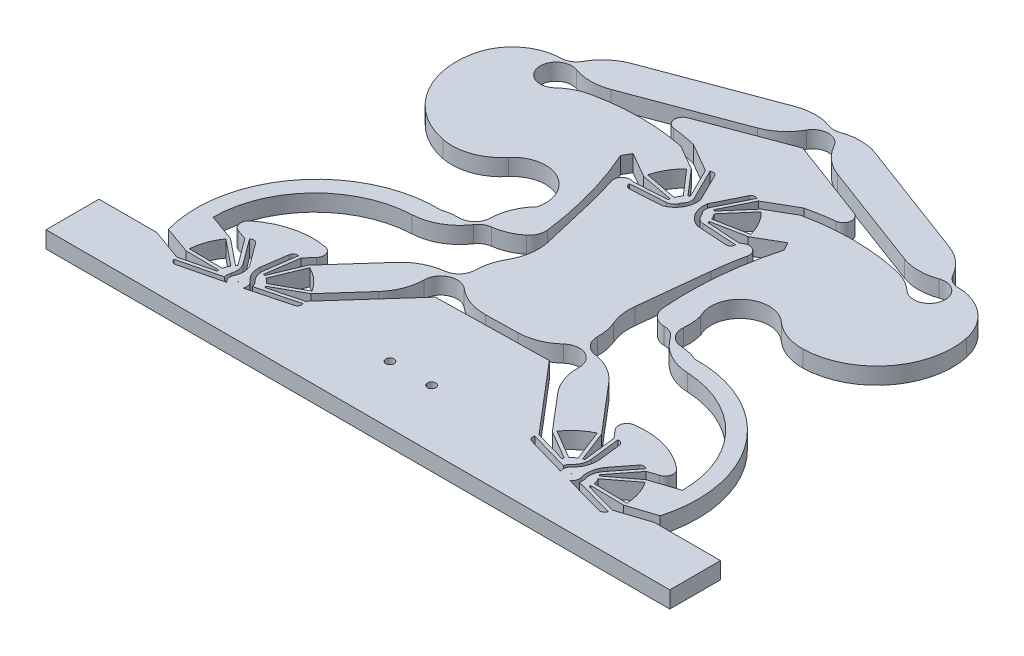
from build123d import *

# Parameters (mm, degrees)
SKETCH1_W           = 300
SKETCH1_H           = 300
BOSS_EXTRUDE1_DEPTH = 10
SKETCH6_W           = 37.369314657
SKETCH6_H           = 300
BOSS_EXTRUDE2_DEPTH = 10
SKETCH11_W          = 80.943448591
SKETCH11_H          = 300
BOSS_EXTRUDE3_DEPTH = 10
SKETCH2_R           = 0.1
CUT_EXTRUDE1_DEPTH  = 10
SKETCH7_R           = 0.1
CUT_EXTRUDE5_DEPTH  = 10
SKETCH9_R           = 0.1
CUT_EXTRUDE7_DEPTH  = 10
CUT_EXTRUDE6_DEPTH  = 10
SKETCH10_R          = 0.1
CUT_EXTRUDE8_DEPTH  = 10
SKETCH12_R          = 0.1
CUT_EXTRUDE10_DEPTH = 10
CUT_EXTRUDE12_DEPTH = 10
CUT_EXTRUDE13_DEPTH = 10
FILLET1_R           = 30
FILLET2_R           = 30
FILLET3_R           = 30
FILLET4_R           = 10
CUT_EXTRUDE14_DEPTH = 10
BOSS_EXTRUDE4_DEPTH = 10
BOSS_EXTRUDE5_DEPTH = 10
FILLET7_R           = 5
FILLET8_R           = 5
CUT_EXTRUDE15_DEPTH = 10
FILLET9_R           = 5
FILLET10_R          = 5
SKETCH22_R          = 2.5
CUT_EXTRUDE16_DEPTH = 10
BOSS_EXTRUDE6_DEPTH = 10
FILLET11_R          = 30
FILLET12_R          = 10
BOSS_EXTRUDE7_DEPTH = 10
CUT_EXTRUDE17_DEPTH = 10
FILLET13_R          = 5


with BuildPart() as part:
    # Sketch1 → Boss-Extrude1 (new body)
    with BuildSketch(Plane(origin=(0, 0, 0), x_dir=(1, 0, 0), z_dir=(0, 1, 0))):
        Rectangle(SKETCH1_W, SKETCH1_H)
    extrude(amount=BOSS_EXTRUDE1_DEPTH)

    # Sketch6 → Boss-Extrude2 (add)
    with BuildSketch(Plane(origin=(0, 10, 0), x_dir=(1, 0, 0), z_dir=(0, 1, 0))):
        with Locations((168.684657329, 0)):
            Rectangle(SKETCH6_W, SKETCH6_H)
    extrude(amount=-BOSS_EXTRUDE2_DEPTH)

    # Sketch11 → Boss-Extrude3 (add)
    with BuildSketch(Plane(origin=(0, 10, 0), x_dir=(1, 0, 0), z_dir=(0, 1, 0))):
        with Locations((-190.471724295, 0)):
            Rectangle(SKETCH11_W, SKETCH11_H)
    extrude(amount=-BOSS_EXTRUDE3_DEPTH)

    # Sketch2 → Cut-Extrude1 (cut)
    with BuildSketch(Plane(origin=(0, 10, 0), x_dir=(1, 0, 0), z_dir=(0, 1, 0))):
        with Locations(Location((-102.597986042, -119.22892065, 0), (0, 0, 270))):
            Circle(SKETCH2_R)
        with BuildLine():
            Line((-91.646532135, -114.32324462), (-72.286712388, -109.303545489))
            Line((-72.286712388, -109.303545489), (-58.964237394, -94.401135072))
            Line((-58.964237394, -94.401135072), (-63.056122105, -90.743067))
            Line((-63.056122105, -90.743067), (-74.626488646, -103.685583383))
            Line((-74.626488646, -103.685583383), (-92.108674519, -113.400169175))
            ThreePointArc((-92.108674519, -113.400169175), (-91.867672783, -113.856735121), (-91.646532135, -114.32324462))
        make_face()
        with BuildLine():
            Line((-95.822049131, -117.472025954), (-71.695255072, -111.216324777))
            ThreePointArc((-71.695255072, -111.216324777), (-71.829497948, -113.351526598), (-73.434237682, -114.766418238))
            Line((-73.434237682, -114.766418238), (-97.973067223, -121.128953786))
            ThreePointArc((-97.973067223, -121.128953786), (-99.265576377, -115.50131474), (-105.002307179, -114.8449453))
            Line((-105.002307179, -114.8449453), (-101.418143006, -89.749332515))
            ThreePointArc((-101.418143006, -89.749332515), (-100.191185318, -87.996710822), (-98.084304532, -87.625010239))
            Line((-98.084304532, -87.625010239), (-101.608286421, -112.299238503))
            ThreePointArc((-101.608286421, -112.299238503), (-99.643858028, -112.882809425), (-97.93261251, -114.010272376))
            ThreePointArc((-97.93261251, -114.010272376), (-96.621211776, -115.584998398), (-95.822049131, -117.472025954))
        make_face()
        with BuildLine():
            Line((-93.226843981, -111.733475602), (-75.652632512, -101.967752581))
            ThreePointArc((-75.652632512, -101.967752581), (-81.270564181, -95.372242827), (-88.451852215, -90.525490581))
            Line((-88.451852215, -90.525490581), (-96.195220365, -109.079802872))
            ThreePointArc((-96.195220365, -109.079802872), (-94.600202844, -110.282666466), (-93.226843981, -111.733475602))
        make_face()
        with BuildLine():
            Line((-82.794990967, -73.096889004), (-78.703106256, -76.754957075))
            Line((-78.703106256, -76.754957075), (-90.273472796, -89.697473458))
            Line((-90.273472796, -89.697473458), (-97.976293575, -108.154627953))
            ThreePointArc((-97.976293575, -108.154627953), (-98.456903938, -107.966086237), (-98.945179165, -107.79839127))
            Line((-98.945179165, -107.79839127), (-96.11746596, -87.999299421))
            Line((-96.11746596, -87.999299421), (-82.794990967, -73.096889004))
        make_face()
    extrude(amount=-CUT_EXTRUDE1_DEPTH, mode=Mode.SUBTRACT)

    # Sketch7 → Cut-Extrude5 (cut)
    with BuildSketch(Plane(origin=(0, 10, 0), x_dir=(1, 0, 0), z_dir=(0, 1, 0))):
        with Locations(Location((97.402013958, -119.22892065, 0), (0, 0, 270))):
            Circle(SKETCH7_R)
        with BuildLine():
            Line((94.028008861, -107.71301471), (91.682181806, -87.851063763))
            Line((91.682181806, -87.851063763), (78.725718188, -72.629361273))
            Line((78.725718188, -72.629361273), (74.546162669, -76.186930412))
            Line((74.546162669, -76.186930412), (85.798653908, -89.406747095))
            Line((85.798653908, -89.406747095), (93.050753939, -108.045605567))
            ThreePointArc((93.050753939, -108.045605567), (93.535803353, -107.868796727), (94.028008861, -107.71301471))
        make_face()
        with BuildLine():
            Line((96.580974488, -112.277237818), (93.657533723, -87.524672641))
            ThreePointArc((93.657533723, -87.524672641), (95.754761468, -87.947453617), (96.938774133, -89.729368873))
            Line((96.938774133, -89.729368873), (99.912141189, -114.904656402))
            ThreePointArc((99.912141189, -114.904656402), (94.161156338, -115.4214488), (92.732296027, -121.016022899))
            Line((92.732296027, -121.016022899), (68.355298748, -114.059154531))
            ThreePointArc((68.355298748, -114.059154531), (66.785409855, -112.605690794), (66.703084838, -110.467857649))
            Line((66.703084838, -110.467857649), (90.670763986, -117.307912108))
            ThreePointArc((90.670763986, -117.307912108), (91.515539141, -115.440858582), (92.86481329, -113.89846006))
            ThreePointArc((92.86481329, -113.89846006), (94.602947197, -112.812907459), (96.580974488, -112.277237818))
        make_face()
        with BuildLine():
            Line((91.247727873, -108.927233275), (83.957453048, -90.190260523))
            ThreePointArc((83.957453048, -90.190260523), (76.66052519, -94.861100811), (70.884003253, -101.318166667))
            Line((70.884003253, -101.318166667), (88.215752445, -111.508001053))
            ThreePointArc((88.215752445, -111.508001053), (89.62395567, -110.09098821), (91.247727873, -108.927233275))
        make_face()
        with BuildLine():
            Line((54.38437804, -93.348310961), (58.563933558, -89.790741823))
            Line((58.563933558, -89.790741823), (69.816424797, -103.010558506))
            Line((69.816424797, -103.010558506), (87.057418022, -113.147034846))
            ThreePointArc((87.057418022, -113.147034846), (86.805394414, -113.597610478), (86.572984435, -114.058609287))
            Line((86.572984435, -114.058609287), (67.340841659, -108.570013451))
            Line((67.340841659, -108.570013451), (54.38437804, -93.348310961))
        make_face()
    extrude(amount=-CUT_EXTRUDE5_DEPTH, mode=Mode.SUBTRACT)

    # Sketch9 → Cut-Extrude7 (cut)
    with BuildSketch(Plane(origin=(0, 10, 0), x_dir=(1, 0, 0), z_dir=(0, 1, 0))):
        with Locations(Location((-4.298011449, 51.362589388, 0), (0, 0, 270))):
            Circle(SKETCH9_R)
        with BuildLine():
            Line((-9.192265136, 40.406026019), (-20.278753654, 23.760012312))
            Line((-20.278753654, 23.760012312), (-20.27739859, 3.770760841))
            Line((-20.27739859, 3.770760841), (-14.788775596, 3.771132913))
            Line((-14.788775596, 3.771132913), (-14.789952449, 21.131493244))
            Line((-14.789952449, 21.131493244), (-8.232489324, 40.025928334))
            ThreePointArc((-8.232489324, 40.025928334), (-8.716466361, 40.205651807), (-9.192265136, 40.406026019))
        make_face()
        with BuildLine():
            Line((-8.17828243, 45.53648459), (-21.994600391, 24.791717858))
            ThreePointArc((-21.994600391, 24.791717858), (-23.317706894, 26.472936806), (-23.064483156, 28.597315705))
            Line((-23.064483156, 28.597315705), (-9.012211208, 49.696359924))
            ThreePointArc((-9.012211208, 49.696359924), (-4.297672501, 46.362589399), (0.416414174, 49.696999087))
            Line((0.416414174, 49.696999087), (14.471546586, 28.599860259))
            ThreePointArc((14.471546586, 28.599860259), (14.725058343, 26.475515711), (13.402179791, 24.794117393))
            Line((13.402179791, 24.794117393), (-0.416950604, 45.537010728))
            ThreePointArc((-0.416950604, 45.537010728), (-2.270353792, 44.662693536), (-4.297536921, 44.362589404))
            ThreePointArc((-4.297536921, 44.362589404), (-6.32476072, 44.662418689), (-8.17828243, 45.53648459))
        make_face()
        with BuildLine():
            Line((-6.288015442, 39.52874453), (-12.879996817, 20.534849815))
            ThreePointArc((-12.879996817, 20.534849815), (-4.29584218, 19.362589461), (4.288153443, 20.536013638))
            Line((4.288153443, 20.536013638), (-2.30640305, 39.529014442))
            ThreePointArc((-2.30640305, 39.529014442), (-4.297197973, 39.362589415), (-6.288015442, 39.52874453))
        make_face()
        with BuildLine():
            Line((11.687828011, 3.772927752), (6.199205018, 3.772555681))
            Line((6.199205018, 3.772555681), (6.198028165, 21.132916012))
            Line((6.198028165, 21.132916012), (-0.361996594, 40.026461872))
            ThreePointArc((-0.361996594, 40.026461872), (0.121956073, 40.20625096), (0.597727677, 40.40668968))
            Line((0.597727677, 40.40668968), (11.686472947, 23.762179223))
            Line((11.686472947, 23.762179223), (11.687828011, 3.772927752))
        make_face()
    extrude(amount=-CUT_EXTRUDE7_DEPTH, mode=Mode.SUBTRACT)

    # Sketch8 → Cut-Extrude6 (cut)
    with BuildSketch(Plane(origin=(0, 10, 0), x_dir=(1, 0, 0), z_dir=(0, 1, 0))):
        with BuildLine():
            Line((-78.703106256, -76.754957075), (-54.138077533, -49.276718976))
            ThreePointArc((-54.138077533, -49.276718976), (-40.018046382, -48.486326488), (-40.80843887, -34.366295337))
            Line((-40.80843887, -34.366295337), (-14.789952449, -5.262231469))
            Line((-14.789952449, -5.262231469), (-14.788775596, 3.771132913))
            Line((-14.788775596, 3.771132913), (-20.27739859, 3.770760841))
            Line((-20.27739859, 3.770760841), (-20.278753654, -3.166742642))
            Line((-20.278753654, -3.166742642), (-82.794990967, -73.096889004))
            Line((-82.794990967, -73.096889004), (-78.703106256, -76.754957075))
        make_face()
        with BuildLine():
            Line((54.38437804, -93.348310961), (31.817052737, -66.835435083))
            Line((31.817052737, -66.835435083), (-35.451668434, -68.100169764))
            Line((-35.451668434, -68.100169764), (-58.964237394, -94.401135072))
            Line((-58.964237394, -94.401135072), (-63.056122105, -90.743067))
            Line((-63.056122105, -90.743067), (-44.463192374, -69.945169474))
            ThreePointArc((-44.463192374, -69.945169474), (-41.897795613, -53.368842887), (-27.798433074, -62.455307527))
            Line((-27.798433074, -62.455307527), (24.304404998, -61.475710098))
            ThreePointArc((24.304404998, -61.475710098), (38.411339196, -52.170792129), (40.784353275, -68.902674721))
            Line((40.784353275, -68.902674721), (58.563933558, -89.790741823))
            Line((58.563933558, -89.790741823), (54.38437804, -93.348310961))
        make_face()
        with BuildLine():
            Line((74.546162669, -76.186930412), (50.315381049, -47.719768401))
            ThreePointArc((50.315381049, -47.719768401), (36.218722109, -46.586539941), (37.351950569, -32.489881001))
            Line((37.351950569, -32.489881001), (6.199182178, 4.109470961))
            Line((6.199182178, 4.109470961), (11.686472947, 6.130667405))
            Line((11.686472947, 6.130667405), (78.725718188, -72.629361273))
            Line((78.725718188, -72.629361273), (74.546162669, -76.186930412))
        make_face()
    extrude(amount=-CUT_EXTRUDE6_DEPTH, mode=Mode.SUBTRACT)

    # Sketch10 → Cut-Extrude8 (cut)
    with BuildSketch(Plane(origin=(0, 10, 0), x_dir=(1, 0, 0), z_dir=(0, 1, 0))):
        with Locations(Location((-102.597986042, -119.22892065, 0), (0, 0, 270))):
            Circle(SKETCH10_R)
        with Locations(Location((97.402013958, -119.22892065, 0), (0, 0, 270))):
            Circle(SKETCH10_R)
        with BuildLine():
            Line((-111.248936494, -110.912607989), (-123.155436608, -94.842908084))
            Line((-123.155436608, -94.842908084), (-141.963397914, -88.073065567))
            Line((-141.963397914, -88.073065567), (-143.822252577, -93.237331424))
            Line((-143.822252577, -93.237331424), (-127.487824755, -99.1168365))
            Line((-127.487824755, -99.1168365), (-111.931675559, -111.686889094))
            ThreePointArc((-111.931675559, -111.686889094), (-111.598635825, -111.292403562), (-111.248936494, -110.912607989))
        make_face()
        with BuildLine():
            Line((-106.765261082, -113.604525683), (-121.603502345, -93.577978677))
            ThreePointArc((-121.603502345, -93.577978677), (-119.573489424, -92.902585823), (-117.660478654, -93.860446858))
            Line((-117.660478654, -93.860446858), (-102.568831079, -114.229005652))
            ThreePointArc((-102.568831079, -114.229005652), (-107.302504691, -117.535549963), (-105.762062656, -123.10043446))
            Line((-105.762062656, -123.10043446), (-130.372961181, -129.178237322))
            ThreePointArc((-130.372961181, -129.178237322), (-132.457590158, -128.697165606), (-133.591476371, -126.882941247))
            Line((-133.591476371, -126.882941247), (-109.39382345, -120.907191762))
            ThreePointArc((-109.39382345, -120.907191762), (-109.588633741, -118.867195958), (-109.18431215, -116.858201688))
            ThreePointArc((-109.18431215, -116.858201688), (-108.215510969, -115.05238935), (-106.765261082, -113.604525683))
        make_face()
        with BuildLine():
            Line((-113.058133277, -113.347992167), (-128.696169481, -100.711771269))
            ThreePointArc((-128.696169481, -100.711771269), (-132.706905393, -108.39134825), (-134.510577976, -116.865347918))
            Line((-134.510577976, -116.865347918), (-114.406602423, -117.094306126))
            ThreePointArc((-114.406602423, -117.094306126), (-113.888830799, -115.164831), (-113.058133277, -113.347992167))
        make_face()
        with BuildLine():
            Line((-152.789193488, -118.149266566), (-150.930338825, -112.985000709))
            Line((-150.930338825, -112.985000709), (-134.595911003, -118.864505784))
            Line((-134.595911003, -118.864505784), (-114.597207903, -119.092265075))
            ThreePointArc((-114.597207903, -119.092265075), (-114.591980926, -119.608508214), (-114.564553874, -120.124048762))
            Line((-114.564553874, -120.124048762), (-133.981232182, -124.919109083))
            Line((-133.981232182, -124.919109083), (-152.789193488, -118.149266566))
        make_face()
        with BuildLine():
            Line((109.339089265, -120.45620754), (128.615034544, -125.788930446))
            Line((128.615034544, -125.788930446), (147.603841538, -119.544301943))
            Line((147.603841538, -119.544301943), (145.889199465, -114.330379709))
            Line((145.889199465, -114.330379709), (129.397709918, -119.753744416))
            Line((129.397709918, -119.753744416), (109.400399943, -119.425729562))
            ThreePointArc((109.400399943, -119.425729562), (109.380830595, -119.941628138), (109.339089265, -120.45620754))
        make_face()
        with BuildLine():
            Line((104.148594805, -121.095373667), (128.170861961, -127.741174559))
            ThreePointArc((128.170861961, -127.741174559), (126.98700331, -129.523192141), (124.889812113, -129.946154377))
            Line((124.889812113, -129.946154377), (100.457294578, -123.186857023))
            ThreePointArc((100.457294578, -123.186857023), (102.151768339, -117.66692407), (97.51179845, -114.230126059))
            Line((97.51179845, -114.230126059), (113.163582067, -94.28876995))
            ThreePointArc((113.163582067, -94.28876995), (115.102469441, -93.384433885), (117.112932016, -94.11597213))
            Line((117.112932016, -94.11597213), (101.723960046, -113.722489681))
            ThreePointArc((101.723960046, -113.722489681), (103.133419476, -115.210091121), (104.051670092, -117.042125438))
            ThreePointArc((104.051670092, -117.042125438), (104.40001343, -119.061578544), (104.148594805, -121.095373667))
        make_face()
        with BuildLine():
            Line((109.265383569, -117.423245857), (129.367958664, -117.752987369))
            ThreePointArc((129.367958664, -117.752987369), (127.800441998, -109.232142536), (124.004640252, -101.444087948))
            Line((124.004640252, -101.444087948), (108.021530578, -113.640909667))
            ThreePointArc((108.021530578, -113.640909667), (108.801424473, -115.480128857), (109.265383569, -117.423245857))
        make_face()
        with BuildLine():
            Line((137.617926587, -89.178906854), (139.332568661, -94.392829088))
            Line((139.332568661, -94.392829088), (122.841079114, -99.816193795))
            Line((122.841079114, -99.816193795), (106.941663391, -111.949148079))
            ThreePointArc((106.941663391, -111.949148079), (106.619713465, -111.545560982), (106.280702199, -111.156195266))
            Line((106.280702199, -111.156195266), (118.629119593, -95.423535356))
            Line((118.629119593, -95.423535356), (137.617926587, -89.178906854))
        make_face()
    extrude(amount=-CUT_EXTRUDE8_DEPTH, mode=Mode.SUBTRACT)

    # Sketch12 → Cut-Extrude10 (cut)
    # profile 1 of 7: a face of its own
    with BuildSketch(Plane(origin=(0, 10, 0), x_dir=(1, 0, 0), z_dir=(0, 1, 0))):
        with BuildLine():
            Line((27.561332768, 49.322329568), (2.687678802, 50.915228543))
            ThreePointArc((2.687678802, 50.915228543), (1.954036453, 54.510905928), (-0.497914525, 57.241302118))
            Line((-0.497914525, 57.241302118), (-0.951262483, 58.125887496))
            Line((-0.951262483, 58.125887496), (9.860864618, 79.97564065))
            ThreePointArc((9.860864618, 79.97564065), (7.743291685, 80.280587924), (6.030311219, 78.998868028))
            Line((6.030311219, 78.998868028), (-2.836944994, 61.079419098))
            Line((-2.836944994, 61.079419098), (-3.864486369, 59.002905828))
            Line((-3.864486369, 59.002905828), (-4.181817653, 58.361624964))
            ThreePointArc((-4.181817653, 58.361624964), (-4.298485976, 58.362589372), (-4.415154168, 58.361609146))
            Line((-4.415154168, 58.361609146), (-4.732601523, 59.002905828))
            Line((-4.732601523, 59.002905828), (-5.760493391, 61.079419098))
            Line((-5.760493391, 61.079419098), (-14.630080929, 78.997467467))
            ThreePointArc((-14.630080929, 78.997467467), (-16.343235153, 80.278955106), (-18.460766723, 79.973720737))
            Line((-18.460766723, 79.973720737), (-7.907108709, 58.653568704))
            Line((-7.907108709, 58.653568704), (-8.097667773, 57.241586906))
            ThreePointArc((-8.097667773, 57.241586906), (-10.550154793, 54.510716387), (-11.283640982, 50.914281432))
            Line((-11.283640982, 50.914281432), (-36.157078755, 49.31801012))
            ThreePointArc((-36.157078755, 49.31801012), (-35.362384374, 47.331664528), (-33.395892151, 46.489039876))
            Line((-33.395892151, 46.489039876), (-10.417450958, 47.963698379))
            ThreePointArc((-10.417450958, 47.963698379), (-4.297536921, 44.362589404), (1.821888823, 47.964528079))
            Line((1.821888823, 47.964528079), (24.800529738, 46.492984991))
            ThreePointArc((24.800529738, 46.492984991), (26.766907701, 47.335876251), (27.561332768, 49.322329568))
        make_face()
        with Locations((-4.298011449, 51.362589388)):
            Circle(SKETCH12_R, mode=Mode.SUBTRACT)
    # profile 2 of 7: a face of its own
    with BuildSketch(Plane(origin=(0, 10, 0), x_dir=(1, 0, 0), z_dir=(0, 1, 0))):
        with BuildLine():
            ThreePointArc((-16.083393286, 53.621964291), (-16.169667701, 53.112954444), (-16.23396848, 52.600704789))
            Line((-16.23396848, 52.600704789), (-36.192910004, 51.319824917))
            Line((-36.192910004, 51.319824917), (-53.504787112, 61.313277132))
            Line((-53.504787112, 61.313277132), (-50.760797839, 66.066750112))
            Line((-50.760797839, 66.066750112), (-35.725696348, 57.387589131))
            Line((-35.725696348, 57.387589131), (-16.083393286, 53.621964291))
        make_face()
    # profile 3 of 7: a face of its own
    with BuildSketch(Plane(origin=(0, 10, 0), x_dir=(1, 0, 0), z_dir=(0, 1, 0))):
        with BuildLine():
            Line((-13.551419723, 59.002905828), (-26.704624376, 74.208676517))
            ThreePointArc((-26.704624376, 74.208676517), (-32.011908941, 67.360710709), (-35.287691606, 59.340040345))
            Line((-35.287691606, 59.340040345), (-15.541992169, 55.554593392))
            ThreePointArc((-15.541992169, 55.554593392), (-14.690723008, 57.361884883), (-13.551419723, 59.002905828))
        make_face()
    # profile 4 of 7: a face of its own
    with BuildSketch(Plane(origin=(0, 10, 0), x_dir=(1, 0, 0), z_dir=(0, 1, 0))):
        with BuildLine():
            Line((-12.148608978, 60.438277705), (-25.232938194, 75.564424901))
            Line((-25.232938194, 75.564424901), (-40.268039685, 84.243585882))
            Line((-40.268039685, 84.243585882), (-37.524050412, 88.997058862))
            Line((-37.524050412, 88.997058862), (-20.212173304, 79.003606647))
            Line((-20.212173304, 79.003606647), (-11.33954682, 61.079419098))
            ThreePointArc((-11.33954682, 61.079419098), (-11.750975366, 60.767552378), (-12.148608978, 60.438277705))
        make_face()
    # profile 5 of 7: a face of its own
    with BuildSketch(Plane(origin=(0, 10, 0), x_dir=(1, 0, 0), z_dir=(0, 1, 0))):
        with BuildLine():
            ThreePointArc((3.551355533, 60.439342), (3.153677282, 60.768562759), (2.742206457, 61.080373695))
            Line((2.742206457, 61.080373695), (11.61240271, 79.005764023))
            Line((11.61240271, 79.005764023), (28.922924755, 89.001563279))
            Line((28.922924755, 89.001563279), (31.667558475, 84.24846237))
            Line((31.667558475, 84.24846237), (16.633633836, 75.56726302))
            Line((16.633633836, 75.56726302), (3.551355533, 60.439342))
        make_face()
    # profile 6 of 7: a face of its own
    with BuildSketch(Plane(origin=(0, 10, 0), x_dir=(1, 0, 0), z_dir=(0, 1, 0))):
        with BuildLine():
            Line((6.945400819, 55.556117805), (26.690586846, 59.344241831))
            ThreePointArc((26.690586846, 59.344241831), (23.413716774, 67.364467993), (18.105503816, 74.21171418))
            Line((18.105503816, 74.21171418), (4.954360872, 59.004160328))
            ThreePointArc((4.954360872, 59.004160328), (6.093886635, 57.363293864), (6.945400819, 55.556117805))
        make_face()
    # profile 7 of 7: a face of its own
    with BuildSketch(Plane(origin=(0, 10, 0), x_dir=(1, 0, 0), z_dir=(0, 1, 0))):
        with BuildLine():
            Line((7.487063955, 53.623562124), (27.128856296, 57.391850019))
            Line((27.128856296, 57.391850019), (42.162780935, 66.073049368))
            Line((42.162780935, 66.073049368), (44.907414655, 61.31994846))
            Line((44.907414655, 61.31994846), (27.596892611, 51.324149205))
            Line((27.596892611, 51.324149205), (7.63777761, 52.602323046))
            ThreePointArc((7.63777761, 52.602323046), (7.573407381, 53.114563978), (7.487063955, 53.623562124))
        make_face()
    extrude(amount=-CUT_EXTRUDE10_DEPTH, mode=Mode.SUBTRACT)

    # Sketch15 → Cut-Extrude12 (cut)
    with BuildSketch(Plane(origin=(0, 10, 0), x_dir=(1, 0, 0), z_dir=(0, 1, 0))):
        with BuildLine():
            Line((39.420971271, -13.383711862), (42.319060047, -16.772150469))
            ThreePointArc((42.319060047, -16.772150469), (55.713404964, -17.816910854), (54.668644579, -31.211255771))
            Line((54.668644579, -31.211255771), (57.566733355, -34.599694378))
            ThreePointArc((57.566733355, -34.599694378), (113.655857126, -43.702099475), (139.332568661, -94.392829088))
            Line((139.332568661, -94.392829088), (137.617926587, -89.178906854))
            ThreePointArc((137.617926587, -89.178906854), (108.748964829, -42.558722062), (54.034243988, -38.931339213))
            Line((54.034243988, -38.931339213), (34.593978622, -16.201826493))
            Line((34.593978622, -16.201826493), (39.420971271, -13.383711862))
        make_face()
        with BuildLine():
            Line((54.150196743, 1.703691437), (58.27807117, -3.122609672))
            ThreePointArc((58.27807117, -3.122609672), (57.233310785, -16.516954588), (70.627655701, -17.561714973))
            Line((70.627655701, -17.561714973), (74.755530128, -22.388016081))
            ThreePointArc((74.755530128, -22.388016081), (133.603132396, -50.347409216), (145.889199465, -114.330379709))
            Line((145.889199465, -114.330379709), (147.603841538, -119.544301943))
            ThreePointArc((147.603841538, -119.544301943), (138.92427366, -52.04077504), (79.294445881, -19.233082619))
            Line((79.294445881, -19.233082619), (57.970763007, 5.69851744))
            Line((57.970763007, 5.69851744), (54.150196743, 1.703691437))
        make_face()
        with BuildLine():
            Line((-63.632634958, -35.117435005), (-60.172935913, -31.247444248))
            ThreePointArc((-60.172935913, -31.247444248), (-60.923808777, -17.833414654), (-47.509779183, -17.082541791))
            Line((-47.509779183, -17.082541791), (-36.095715199, -4.314864155))
            Line((-36.095715199, -4.314864155), (-31.995348698, -7.980514787))
            Line((-31.995348698, -7.980514787), (-59.89051547, -39.183817785))
            ThreePointArc((-59.89051547, -39.183817785), (-113.491918235, -42.534997648), (-141.963397914, -88.073065567))
            Line((-141.963397914, -88.073065567), (-143.822252577, -93.237331424))
            ThreePointArc((-143.822252577, -93.237331424), (-118.508832551, -43.783095071), (-63.632634958, -35.117435005))
        make_face()
        with BuildLine():
            Line((-79.288579779, -21.121314409), (-75.828880735, -17.251323652))
            ThreePointArc((-75.828880735, -17.251323652), (-62.414851141, -16.500450788), (-63.165724005, -3.086421194))
            Line((-63.165724005, -3.086421194), (-51.75166002, 9.681256442))
            Line((-51.75166002, 9.681256442), (-55.852026521, 13.346907074))
            Line((-55.852026521, 13.346907074), (-83.38894628, -17.455663776))
            ThreePointArc((-83.38894628, -17.455663776), (-143.551518497, -50.253185184), (-152.789193488, -118.149266566))
            Line((-152.789193488, -118.149266566), (-150.930338825, -112.985000709))
            ThreePointArc((-150.930338825, -112.985000709), (-138.285338487, -48.978978096), (-79.288579779, -21.121314409))
        make_face()
    extrude(amount=-CUT_EXTRUDE12_DEPTH, mode=Mode.SUBTRACT)

    # Sketch16 → Cut-Extrude13 (cut)
    with BuildSketch(Plane(origin=(0, 10, 0), x_dir=(1, 0, 0), z_dir=(0, 1, 0))):
        with BuildLine():
            Line((-2.597986042, 119.88932953), (-77.131565185, 92.022366182))
            ThreePointArc((-77.131565185, 92.022366182), (-57.215949643, 91.974166571), (-37.524050412, 88.997058862))
            Line((-37.524050412, 88.997058862), (-40.268039685, 84.243585882))
            ThreePointArc((-40.268039685, 84.243585882), (-73.171891784, 86.824637463), (-105.679139111, 81.114630334))
            ThreePointArc((-105.679139111, 81.114630334), (-124.281418287, 83.485174081), (-105.888772551, 87.142338423))
            Line((-105.888772551, 87.142338423), (-11.49637184, 122.434210909))
            ThreePointArc((-11.49637184, 122.434210909), (-2.597986042, 135.261181031), (6.300399756, 122.434210909))
            Line((6.300399756, 122.434210909), (100.692800467, 87.142338423))
            ThreePointArc((100.692800467, 87.142338423), (119.085291754, 83.480762619), (100.48066117, 81.123095563))
            ThreePointArc((100.48066117, 81.123095563), (66.275606354, 87.122250716), (31.667558475, 84.24846237))
            Line((31.667558475, 84.24846237), (28.922924755, 89.001563279))
            ThreePointArc((28.922924755, 89.001563279), (49.994353332, 92.250590481), (71.314795751, 92.254472799))
            Line((71.314795751, 92.254472799), (-2.597986042, 119.88932953))
        make_face()
        with BuildLine():
            Line((-2.597986042, 154.05282917), (-124.067653953, 108.637181316))
            ThreePointArc((-124.067653953, 108.637181316), (-154.31003633, 42.276329795), (-87.949184809, 12.033947417))
            ThreePointArc((-87.949184809, 12.033947417), (-72.557085493, 28.73900639), (-55.852026521, 13.346907074))
            Line((-55.852026521, 13.346907074), (-51.75166002, 9.681256442))
            ThreePointArc((-51.75166002, 9.681256442), (-66.724858527, 33.233533734), (-90.27713582, 18.260335227))
            ThreePointArc((-90.27713582, 18.260335227), (-146.925506705, 40.578608573), (-130.643893246, 99.247614975))
            ThreePointArc((-130.643893246, 99.247614975), (-118.353914639, 94.773188599), (-113.243127558, 106.812454397))
            Line((-113.243127558, 106.812454397), (-11.49637184, 144.854007547))
            ThreePointArc((-11.49637184, 144.854007547), (-2.597986042, 138.680977669), (6.300399756, 144.854007547))
            Line((6.300399756, 144.854007547), (108.047155473, 106.812454397))
            ThreePointArc((108.047155473, 106.812454397), (113.157942554, 94.773188599), (125.447921161, 99.247614975))
            ThreePointArc((125.447921161, 99.247614975), (141.72953462, 40.578608573), (85.081163735, 18.260335227))
            ThreePointArc((85.081163735, 18.260335227), (61.337358344, 25.447496828), (54.150196743, 1.703691437))
            Line((54.150196743, 1.703691437), (57.970763007, 5.69851744))
            ThreePointArc((57.970763007, 5.69851744), (67.194272877, 21.257457288), (82.753212724, 12.033947417))
            ThreePointArc((82.753212724, 12.033947417), (149.114064246, 42.276329795), (118.871681868, 108.637181316))
            Line((118.871681868, 108.637181316), (-2.597986042, 154.05282917))
        make_face()
        with BuildLine():
            Line((39.420971271, -13.383711862), (34.593978622, -16.201826493))
            ThreePointArc((34.593978622, -16.201826493), (33.600989607, 25.375103098), (42.162780935, 66.073049368))
            Line((42.162780935, 66.073049368), (44.907414655, 61.31994846))
            ThreePointArc((44.907414655, 61.31994846), (38.490889994, 24.237895826), (39.420971271, -13.383711862))
        make_face()
        with BuildLine():
            Line((-31.995348698, -7.980514787), (-36.095715199, -4.314864155))
            ThreePointArc((-36.095715199, -4.314864155), (-42.19724815, 29.189700926), (-53.504787112, 61.313277132))
            Line((-53.504787112, 61.313277132), (-50.760797839, 66.066750112))
            ThreePointArc((-50.760797839, 66.066750112), (-38.486520296, 29.775910296), (-31.995348698, -7.980514787))
        make_face()
    extrude(amount=-CUT_EXTRUDE13_DEPTH, mode=Mode.SUBTRACT)

    # Fillet1
    # the kernel refuses this fillet: 30 mm, written as the material it takes off along each edge
    with BuildSketch(Plane(origin=(-44.463192374, 51.143782777, 69.945169474), x_dir=(-0.666481933166411, 0, 0.7455211819678658), z_dir=(0, -1, 0)), Plane(origin=(24.304404998, 51.143782777, 61.475710098), x_dir=(-0.9998233037234974, 0, 0.01879790763439075), z_dir=(0, -1, 0)), Plane(origin=(50.315381049, 51.143782777, 47.719768401), x_dir=(0.6481715239835826, 0, 0.7614943699705206), z_dir=(0, -1, 0))) as fillet1_piece_1:
        with BuildLine():
            CenterArc((16.457513111, 30), FILLET1_R, 228.590377891, 41.409622109)
            Line((-3.385621722, 7.5), (-3.782484419, 7.05))
            ThreePointArc((-3.782484419, 7.05), (-1.432484419, 3.867515581), (-0.6, 0))
            Line((-0.6, 0), (0, -0.6))
            Line((0, -0.6), (16.457513111, -0.6))
            Line((16.457513111, -0.6), (16.457513111, 0))
        make_face()
    extrude(amount=92.287565553, mode=Mode.SUBTRACT)
    with BuildSketch(Plane(origin=(-27.798433074, 51.578860281, 62.455307527), x_dir=(-0.41893740169155813, 0, -0.9080151174203688), z_dir=(0, -1, 0))) as fillet1_piece_2:
        with BuildLine():
            CenterArc((20.789430141, 27.283838696), FILLET1_R, 203.690415168, 41.740596453)
            Line((-6.682464493, 15.230000915), (-7.231902385, 14.988924159))
            Line((-7.231902385, 14.988924159), (-0.549437893, -0.241076756))
            Line((-0.549437893, -0.241076756), (0.249473162, -0.545676774))
            ThreePointArc((0.249473162, -0.545676774), (4.157886028, 0.305387101), (8.066298895, -0.545676774))
            Line((8.066298895, -0.545676774), (8.315772056, 0))
        make_face()
    extrude(amount=93.157720562, mode=Mode.SUBTRACT)
    with BuildSketch(Plane(origin=(40.784353275, 51.143782777, 68.902674721), x_dir=(0.42737249057440424, 0, -0.904075635276292), z_dir=(0, -1, 0)), Plane(origin=(37.351950569, 51.143782777, 32.489881001), x_dir=(-0.42737249057440385, 0, 0.9040756352762921), z_dir=(0, -1, 0))) as fillet1_piece_3:
        with BuildLine():
            CenterArc((20.571891388, 27.343134833), FILLET1_R, 204.295188945, 41.409622109)
            Line((-6.771243445, 15), (-7.318106141, 14.753137303))
            Line((-7.318106141, 14.753137303), (-0.546862697, -0.246862697))
            Line((-0.546862697, -0.246862697), (0.246862697, -0.546862697))
            ThreePointArc((0.246862697, -0.546862697), (4.114378278, 0.285621722), (7.981893859, -0.546862697))
            Line((7.981893859, -0.546862697), (8.228756555, 0))
        make_face()
    extrude(amount=92.287565553, mode=Mode.SUBTRACT)
    with BuildSketch(Plane(origin=(-40.80843887, 51.143782777, 34.366295337), x_dir=(0.40528032781907436, 0, 0.9141924610730847), z_dir=(0, -1, 0))) as fillet1_piece_4:
        with BuildLine():
            CenterArc((20.571891388, -27.343134833), FILLET1_R, 114.295188945, 41.409622109)
            Line((-6.771243445, -15), (-7.318106141, -14.753137303))
            Line((-7.318106141, -14.753137303), (-0.546862697, 0.246862697))
            Line((-0.546862697, 0.246862697), (0.246862697, 0.546862697))
            ThreePointArc((0.246862697, 0.546862697), (4.114378278, -0.285621722), (7.981893859, 0.546862697))
            Line((7.981893859, 0.546862697), (8.228756555, 0))
        make_face()
    extrude(amount=92.287565553, mode=Mode.SUBTRACT)
    with BuildSketch(Plane(origin=(-54.138077533, 51.143782777, 49.276718976), x_dir=(-0.6664819331664084, 0, 0.7455211819678682), z_dir=(0, -1, 0))) as fillet1_piece_5:
        with BuildLine():
            CenterArc((16.457513111, -30), FILLET1_R, 90, 41.409622109)
            Line((-3.385621722, -7.5), (-3.782484419, -7.05))
            ThreePointArc((-3.782484419, -7.05), (-1.432484419, -3.867515581), (-0.6, 0))
            Line((-0.6, 0), (0, 0.6))
            Line((0, 0.6), (16.457513111, 0.6))
            Line((16.457513111, 0.6), (16.457513111, 0))
        make_face()
    extrude(amount=92.287565553, mode=Mode.SUBTRACT)
    with BuildSketch(Plane(origin=(70.627655701, 27.52004215, 17.561714973), x_dir=(-0.9461098133922329, 0, 0.323845983459598), z_dir=(0, -1, 0))) as fillet1_piece_6:
        with BuildLine():
            CenterArc((18.073306639, -27.884751426), FILLET1_R, 111.644279329, 21.240405079)
            Line((-2.342444274, -5.903006394), (-2.750759293, -5.463371494))
            ThreePointArc((-2.750759293, -5.463371494), (-1.728917166, -2.730197402), (-0.557695029, 0.221305796))
            Line((-0.557695029, 0.221305796), (0.221305796, 0.557695029))
            ThreePointArc((0.221305796, 0.557695029), (3.50400843, -0.069828715), (6.786711064, 0.557695029))
            Line((6.786711064, 0.557695029), (7.00801686, 0))
        make_face()
    extrude(amount=45.0400843, mode=Mode.SUBTRACT)
    with BuildSketch(Plane(origin=(-75.828880735, 26.629934552, 17.251323652), x_dir=(-0.6664819331664106, 0, 0.7455211819678661), z_dir=(0, -1, 0))) as fillet1_piece_7:
        with BuildLine():
            CenterArc((20.31675429, -25.907743314), FILLET1_R, 120.277746344, 18.734914988)
            Line((-2.32888188, -6.23097624), (-2.781794603, -5.837440899))
            ThreePointArc((-2.781794603, -5.837440899), (-1.163273183, -3.115924579), (-0.6, 0))
            Line((-0.6, 0), (0, 0.6))
            ThreePointArc((0, 0.6), (2.595493495, 0.6), (4.888471645, 0.518154866))
            Line((4.888471645, 0.518154866), (5.190986991, 0))
        make_face()
    extrude(amount=43.259869104, mode=Mode.SUBTRACT)
    with BuildSketch(Plane(origin=(58.27807117, 27.52004215, 3.122609672), x_dir=(-0.649978133232716, 0, -0.7599529105933562), z_dir=(0, -1, 0))) as fillet1_piece_8:
        with BuildLine():
            CenterArc((19.252432896, -27.084083934), FILLET1_R, 115.471036262, 21.240405079)
            Line((-2.584857911, -6.513893604), (-3.021603727, -6.102489798))
            ThreePointArc((-3.021603727, -6.102489798), (-1.227523744, -3.282702634), (-0.6, 0))
            Line((-0.6, 0), (0, 0.6))
            ThreePointArc((0, 0.6), (3.175394844, 0.6), (6.092756824, 0.541681679))
            Line((6.092756824, 0.541681679), (6.350789689, 0))
        make_face()
    extrude(amount=45.0400843, mode=Mode.SUBTRACT)
    with BuildSketch(Plane(origin=(54.668644579, 25.916813678, 31.211255771), x_dir=(0.6499781332327103, 0, 0.7599529105933611), z_dir=(0, -1, 0))) as fillet1_piece_9:
        with BuildLine():
            CenterArc((21.129417549, -24.941707652), FILLET1_R, 123.758183211, 17.085695976)
            Line((-2.133431222, -5.998638549), (-2.598688198, -5.619777167))
            ThreePointArc((-2.598688198, -5.619777167), (-1.114546076, -2.982308247), (-0.6, 0))
            Line((-0.6, 0), (0, 0.6))
            ThreePointArc((0, 0.6), (2.229374057, 0.6), (4.125334726, 0.498834153))
            Line((4.125334726, 0.498834153), (4.458748115, 0))
        make_face()
    extrude(amount=41.833627356, mode=Mode.SUBTRACT)
    with BuildSketch(Plane(origin=(42.319060047, 25.916813678, 16.772150469), x_dir=(0.9338185689535567, 0, -0.3577469500604184), z_dir=(0, -1, 0))) as fillet1_piece_10:
        with BuildLine():
            CenterArc((16.419449899, -28.265575026), FILLET1_R, 109.578060406, 17.085695976)
            Line((-1.494085536, -4.200969312), (-1.852356245, -3.719677198))
            ThreePointArc((-1.852356245, -3.719677198), (-1.312354269, -1.899430167), (-0.565311501, 0.201054489))
            Line((-0.565311501, 0.201054489), (0.201054489, 0.565311501))
            ThreePointArc((0.201054489, 0.565311501), (3.183362736, 0.050765425), (6.165670983, 0.565311501))
            Line((6.165670983, 0.565311501), (6.366725471, 0))
        make_face()
    extrude(amount=41.833627356, mode=Mode.SUBTRACT)
    with BuildSketch(Plane(origin=(-60.172935913, 26.629934552, 31.247444248), x_dir=(-0.4649998868515488, 0, -0.8853107393610713), z_dir=(0, -1, 0))) as fillet1_piece_11:
        with BuildLine():
            CenterArc((17.15509038, -28.101326348), FILLET1_R, 110.493669334, 18.734914988)
            Line((-1.817384714, -4.862453983), (-2.196834216, -4.397676536))
            ThreePointArc((-2.196834216, -4.397676536), (-1.470718884, -2.22116466), (-0.562026527, 0.210062331))
            Line((-0.562026527, 0.210062331), (0.210062331, 0.562026527))
            ThreePointArc((0.210062331, 0.562026527), (3.32598691, -0.001246656), (6.44191149, 0.562026527))
            Line((6.44191149, 0.562026527), (6.651973821, 0))
        make_face()
    extrude(amount=43.259869104, mode=Mode.SUBTRACT)
    with BuildSketch(Plane(origin=(-47.509779183, 50.488325788, 17.082541791), x_dir=(0.6664819331664085, 0, -0.7455211819678681), z_dir=(0, -1, 0))) as fillet1_piece_12:
        with BuildLine():
            CenterArc((16.195330315, -30), FILLET1_R, 90, 40.580418656)
            Line((-3.320110431, -7.215189873), (-3.710419245, -6.759493671))
            ThreePointArc((-3.710419245, -6.759493671), (-1.414912842, -3.720398586), (-0.6, 0))
            Line((-0.6, 0), (0, 0.6))
            Line((0, 0.6), (16.195330315, 0.6))
            Line((16.195330315, 0.6), (16.195330315, 0))
        make_face()
    extrude(amount=90.976651575, mode=Mode.SUBTRACT)
    with BuildSketch(Plane(origin=(-63.165724005, 50.488325788, 3.086421194), x_dir=(0.39865452724882855, 0, 0.9171011764816427), z_dir=(0, -1, 0))) as fillet1_piece_13:
        with BuildLine():
            CenterArc((20.483093341, -27.253102781), FILLET1_R, 114.709790672, 40.580418656)
            Line((-6.77000944, -14.712433388), (-7.315071495, -14.46162))
            Line((-7.315071495, -14.46162), (-0.545062056, 0.250813388))
            Line((-0.545062056, 0.250813388), (0.250813388, 0.545062056))
            ThreePointArc((0.250813388, 0.545062056), (3.971211974, -0.269850786), (7.691610561, 0.545062056))
            Line((7.691610561, 0.545062056), (7.942423949, 0))
        make_face()
    extrude(amount=90.976651575, mode=Mode.SUBTRACT)

    # Fillet2
    fillet2_edges = [part.edges().sort_by_distance(p)[0] for p in [
        (57.566733355, 5, 34.599694378),
        (-63.632634958, 5, 35.117435005),
        (100.692800467, 5, -87.142338423),
        (6.300399756, 5, -122.434210909),
        (-11.49637184, 5, -122.434210909),
        (-105.888772551, 5, -87.142338423),
        (100.48066117, 5, -81.123095563),
        (125.447921161, 5, -99.247614975),
        (108.047155473, 5, -106.812454397),
        (6.300399756, 5, -144.854007547),
        (-11.49637184, 5, -144.854007547),
        (-105.679139111, 5, -81.114630334),
        (-113.243127558, 5, -106.812454397),
        (-130.643893246, 5, -99.247614975),
    ]]
    fillet(fillet2_edges, radius=FILLET2_R)

    # Fillet3
    fillet3_edges = [part.edges().sort_by_distance(p)[0] for p in [
        (85.081163735, 5, -18.260335227),
        (-90.27713582, 5, -18.260335227),
    ]]
    fillet(fillet3_edges, radius=FILLET3_R)

    # Fillet4
    fillet4_edges = [part.edges().sort_by_distance(p)[0] for p in [
        (-36.095715199, 5, 4.314864155),
        (39.420971271, 5, 13.383711862),
    ]]
    fillet(fillet4_edges, radius=FILLET4_R)

    # Sketch17 → Cut-Extrude14 (cut)
    with BuildSketch(Plane(origin=(0, 10, 0), x_dir=(1, 0, 0), z_dir=(0, 1, 0))):
        with BuildLine():
            Line((-55.852026521, 13.346907074), (-83.38894628, -17.455663776))
            ThreePointArc((-83.38894628, -17.455663776), (-143.551518497, -50.253185184), (-152.789193488, -118.149266566))
            Line((-152.789193488, -118.149266566), (-187.489858846, -118.149266566))
            Line((-187.489858846, -118.149266566), (-187.489858846, -150))
            Line((-187.489858846, -150), (-230.943448591, -150))
            Line((-230.943448591, -150), (-230.943448591, -118.149266566))
            Line((-230.943448591, -118.149266566), (-248.468486257, -118.149266566))
            Line((-248.468486257, -118.149266566), (-248.468486257, 150))
            Line((-248.468486257, 150), (-13.437770051, 150))
            Line((-13.437770051, 150), (-124.067653953, 108.637181316))
            ThreePointArc((-124.067653953, 108.637181316), (-154.31003633, 42.276329795), (-87.949184809, 12.033947417))
            ThreePointArc((-87.949184809, 12.033947417), (-72.557085493, 28.73900639), (-55.852026521, 13.346907074))
        make_face()
        with BuildLine():
            Line((79.294445881, -19.233082619), (57.970763007, 5.69851744))
            ThreePointArc((57.970763007, 5.69851744), (67.194272877, 21.257457288), (82.753212724, 12.033947417))
            ThreePointArc((82.753212724, 12.033947417), (149.114064246, 42.276329795), (118.871681868, 108.637181316))
            Line((118.871681868, 108.637181316), (8.241797967, 150))
            Line((8.241797967, 150), (187.369314657, 150))
            Line((187.369314657, 150), (187.369314657, -119.544301943))
            Line((187.369314657, -119.544301943), (147.603841538, -119.544301943))
            ThreePointArc((147.603841538, -119.544301943), (138.92427366, -52.04077504), (79.294445881, -19.233082619))
        make_face()
    extrude(amount=-CUT_EXTRUDE14_DEPTH, mode=Mode.SUBTRACT)

    # Sketch18 → Boss-Extrude4 (add)
    with BuildSketch(Plane(origin=(0, 10, 0), x_dir=(1, 0, 0), z_dir=(0, 1, 0))):
        with BuildLine():
            Line((34.593978622, -16.201826493), (54.034243988, -38.931339213))
            ThreePointArc((54.034243988, -38.931339213), (55.234273567, -38.426776709), (56.444977488, -37.948393675))
            Line((56.444977488, -37.948393675), (34.172777271, -12.992973704))
            ThreePointArc((34.172777271, -12.992973704), (34.376176395, -14.598345391), (34.593978622, -16.201826493))
        make_face()
    extrude(amount=-BOSS_EXTRUDE4_DEPTH)

    # Sketch20 → Boss-Extrude5 (add)
    with BuildSketch(Plane(origin=(0, 10, 0), x_dir=(1, 0, 0), z_dir=(0, 1, 0))):
        with BuildLine():
            Line((-9.522617548, 68.679538307), (0.924246783, 68.680246496))
            ThreePointArc((0.924246783, 68.680246496), (-0.685491804, 53.448605112), (13.311209281, 47.228756535))
            Line((13.311209281, 47.228756535), (8.088390425, 38.18115254))
            ThreePointArc((8.088390425, 38.18115254), (-4.297731352, 47.230732598), (-16.682626079, 38.179473321))
            Line((-16.682626079, 38.179473321), (-21.906671555, 47.226369128))
            ThreePointArc((-21.906671555, 47.226369128), (-7.938977344, 53.464372947), (-9.522617548, 68.679538307))
        make_face()
    extrude(amount=-BOSS_EXTRUDE5_DEPTH)

    # Fillet7
    # the kernel refuses this fillet: 5 mm, written as the material it takes off along each edge
    with BuildSketch(Plane(origin=(-8.097667773, 13.639498685, -57.241586906), x_dir=(0.13374606671626293, 0, -0.9910156354154706), z_dir=(0, -1, 0))) as fillet7_piece_1:
        with BuildLine():
            CenterArc((1.98738409, -4.968247128), FILLET7_R, 96.46062061, 31.040801617)
            Line((-1.05652152, -1.001555983), (-1.117399632, -0.92222216))
            ThreePointArc((-1.117399632, -0.92222216), (-0.570950784, -0.455745133), (-0.075971277, 0.06502588))
            Line((-0.075971277, 0.06502588), (0, 0.1))
            ThreePointArc((0, 0.1), (0.712391282, 0.1), (1.413530533, 0.099364943))
            Line((1.413530533, 0.099364943), (1.424782564, 0))
        make_face()
    extrude(amount=17.27899737, mode=Mode.SUBTRACT)
    with BuildSketch(Plane(origin=(-0.497914525, 12.484974423, -57.241302118), x_dir=(0.8042700567749662, 0, 0.5942639781908311), z_dir=(0, -1, 0))) as fillet7_piece_2:
        with BuildLine():
            CenterArc((1.186693979, -4.990238098), FILLET7_R, 93.580886331, 20.96343857)
            Line((-0.890291414, -0.44203717), (-0.931831122, -0.351073152))
            ThreePointArc((-0.931831122, -0.351073152), (-0.489616705, -0.131451123), (-0.044470998, 0.089567462))
            Line((-0.044470998, 0.089567462), (0.006245758, 0.099804762))
            ThreePointArc((0.006245758, 0.099804762), (0.437203045, 0.086333337), (0.868160332, 0.099804762))
            Line((0.868160332, 0.099804762), (0.87440609, 0))
        make_face()
    extrude(amount=14.969948846, mode=Mode.SUBTRACT)
    with BuildSketch(Plane(origin=(-11.283640982, 19.771780287, -50.914281432), x_dir=(0.15022896323902923, 0, -0.9886512320349004), z_dir=(0, -1, 0))) as fillet7_piece_3:
        with BuildLine():
            CenterArc((4.051516828, -4.885001718), FILLET7_R, 102.312159176, 65.375681648)
            Line((-0.83348489, -3.818813079), (-0.931184924, -3.797489306))
            Line((-0.931184924, -3.797489306), (-0.097700034, 0.021323773))
            Line((-0.097700034, 0.021323773), (0.021323773, 0.097700034))
            ThreePointArc((0.021323773, 0.097700034), (1.492664095, -0.060997595), (2.964004416, 0.097700034))
            Line((2.964004416, 0.097700034), (2.985328189, 0))
        make_face()
    extrude(amount=29.543560573, mode=Mode.SUBTRACT)
    with BuildSketch(Plane(origin=(2.687678802, 19.771780287, -50.915228543), x_dir=(0.9979557500607878, 0, 0.06390869205836049), z_dir=(0, -1, 0)), Plane(origin=(-8.17828243, 19.771780287, -45.53648459), x_dir=(-0.5543244258755551, 0, 0.8323006853762264), z_dir=(0, -1, 0))) as fillet7_piece_4:
        with BuildLine():
            CenterArc((3.908712115, -5), FILLET7_R, 90, 65.375681648)
            Line((-0.6365846, -2.916666667), (-0.727490534, -2.875))
            ThreePointArc((-0.727490534, -2.875), (-0.258697629, -1.471340322), (-0.1, 0))
            Line((-0.1, 0), (0, 0.1))
            Line((0, 0.1), (3.908712115, 0.1))
            Line((3.908712115, 0.1), (3.908712115, 0))
        make_face()
    extrude(amount=29.543560573, mode=Mode.SUBTRACT)
    with BuildSketch(Plane(origin=(-0.416950604, 19.771780287, -45.537010728), x_dir=(0.5544372635124617, 0, 0.8322255228174711), z_dir=(0, -1, 0))) as fillet7_piece_5:
        with BuildLine():
            CenterArc((3.908712115, 5), FILLET7_R, 204.624318352, 65.375681648)
            Line((-0.6365846, 2.916666667), (-0.727490534, 2.875))
            ThreePointArc((-0.727490534, 2.875), (-0.258697629, 1.471340322), (-0.1, 0))
            Line((-0.1, 0), (0, -0.1))
            Line((0, -0.1), (3.908712115, -0.1))
            Line((3.908712115, -0.1), (3.908712115, 0))
        make_face()
    extrude(amount=29.543560573, mode=Mode.SUBTRACT)

    # Fillet8
    fillet8_edges = [part.edges().sort_by_distance(p)[0] for p in [
        (-0.951262483, 5, -58.125887496),
        (-7.907108709, 5, -58.653568704),
    ]]
    fillet(fillet8_edges, radius=FILLET8_R)

    # Sketch21 → Cut-Extrude15 (cut)
    with BuildSketch(Plane(origin=(0, 10, 0), x_dir=(1, 0, 0), z_dir=(0, 1, 0))):
        with BuildLine():
            Line((51.684925041, -40.860900336), (11.687668276, 6.129263091))
            Line((11.687668276, 6.129263091), (33.898483602, 28.340078417))
            ThreePointArc((33.898483602, 28.340078417), (32.846999657, 7.665664386), (34.172777271, -12.992973704))
            Line((34.172777271, -12.992973704), (56.444977488, -37.948393675))
            Line((56.444977488, -37.948393675), (51.684925041, -40.860900336))
        make_face()
        with BuildLine():
            Line((-20.278753654, -3.166742642), (-56.063132564, -43.194853133))
            Line((-56.063132564, -43.194853133), (-59.89051547, -39.183817785))
            Line((-59.89051547, -39.183817785), (-31.995348698, -7.980514787))
            ThreePointArc((-31.995348698, -7.980514787), (-34.136299371, 8.820609149), (-37.428188476, 25.434606303))
            Line((-37.428188476, 25.434606303), (-20.278753654, -3.166742642))
        make_face()
    extrude(amount=-CUT_EXTRUDE15_DEPTH, mode=Mode.SUBTRACT)

    # Fillet9
    # the kernel refuses this fillet: 5 mm, written as the material it adds along each edge
    with BuildSketch(Plane(origin=(-14.789952449, 10, 5.262231469), x_dir=(-0.6664819331664088, 0, 0.7455211819678678), z_dir=(0, -1, 0))) as fillet9_piece_1:
        with BuildLine():
            CenterArc((FILLET9_R * 0.381749396599, FILLET9_R), FILLET9_R, 228.211348465, 41.788651535)
            Line((-FILLET9_R * 0.284635405576, FILLET9_R * 0.254391996133), (0, 0))
            Line((0, 0), (FILLET9_R * 0.381749396599, 0))
        make_face()
    extrude(amount=10)
    # the kernel refuses this fillet: 5 mm, written as the material it takes off along each edge
    with BuildSketch(Plane(origin=(6.485942397, 13.18910758, -3.772575119), x_dir=(-0.9999999977022822, 0, 6.778964254659205e-05), z_dir=(0, -1, 0))) as fillet9_2_piece_1:
        with BuildLine():
            CenterArc((2.980921902, -4.212050541), FILLET9_R, 122.604496942, 16.995503058)
            Line((-0.826769636, -0.971451036), (0, 0))
            Line((0, 0), (0.28673738, 0))
        make_face()
    extrude(amount=16.378215161, mode=Mode.SUBTRACT)
    with BuildSketch(Plane(origin=(-56.063132564, 21.545565674, 43.194853133), x_dir=(-0.6903499628818998, 0, -0.7234755896013075), z_dir=(0, -1, 0))) as fillet9_2_piece_2:
        with BuildLine():
            CenterArc((FILLET9_R * 0.923645253896, -FILLET9_R), FILLET9_R, 90, 85.453933789)
            Line((-FILLET9_R * 0.0732086759594, -FILLET9_R * 0.920739401138), (0, 0))
            Line((0, 0), (FILLET9_R * 0.923645253896, 0))
        make_face()
    extrude(amount=33.091131347, mode=Mode.SUBTRACT)
    with BuildSketch(Plane(origin=(51.684925041, 24.602830424, 40.860900336), x_dir=(0.6481715239835923, 0, 0.7614943699705122), z_dir=(0, -1, 0))) as fillet9_2_piece_3:
        with BuildLine():
            CenterArc((5.84113217, -5), FILLET9_R, 90, 95.883806732)
            Line((0.867473024, -5.51255702), (0, 0))
            Line((0, 0), (5.84113217, 0))
        make_face()
    extrude(amount=39.205660849, mode=Mode.SUBTRACT)
    with BuildSketch(Plane(origin=(-20.278753654, 55.152975523, 3.166742642), x_dir=(3.327540765411203e-05, 0, -0.9999999994463736), z_dir=(0, -1, 0))) as fillet9_2_piece_4:
        with BuildLine():
            CenterArc((18.060684884, -4.999999974), FILLET9_R, 89.994209399, 149.05688496)
            Line((15.489317491, -9.288131238), (15.232180752, -9.716944364))
            Line((15.232180752, -9.716944364), (-0.257136739, -0.428813126))
            Line((-0.257136739, -0.428813126), (-8.1025e-05, 0.499999993))
            ThreePointArc((-8.1025e-05, 0.499999993), (6.937554057, 0.501124213), (18.061240742, 0.499999997))
            Line((18.061240742, 0.499999997), (18.061190209, 0))
        make_face()
    extrude(amount=100.305951046, mode=Mode.SUBTRACT)
    with BuildSketch(Plane(origin=(11.687668276, -30.174776662, -6.129263091), x_dir=(0.7071067811865474, 0, -0.7071067811865477), z_dir=(0, 1, 0))) as fillet9_2_piece_5:
        with BuildLine():
            CenterArc((FILLET9_R * 2.41398213299, FILLET9_R), FILLET9_R, 135.00388406, 134.99611594)
            Line((FILLET9_R * 1.70682741892, FILLET9_R * 1.70705884505), (0, 0))
            Line((0, 0), (FILLET9_R * 2.41398213299, 0))
        make_face()
    extrude(amount=70.349553325, mode=Mode.SUBTRACT)
    with BuildSketch(Plane(origin=(-47.396988643, -33.418008453, -57.78749008), x_dir=(0.3340384389838331, 0, 0.942559452385495), z_dir=(0, 1, 0))) as fillet9_2_piece_6:
        with BuildLine():
            CenterArc((13.503042879, 4.998154422), FILLET9_R, 137.126545372, 131.316657096)
            Line((9.838751874, 8.400061451), (0, 0))
            ThreePointArc((0, 0), (6.683601691, 0.090806469), (13.367203381, 0))
        make_face()
    extrude(amount=76.836016906, mode=Mode.SUBTRACT)
    with BuildSketch(Plane(origin=(39.770233941, -29.502844372, -58.353531443), x_dir=(-0.8659915069732894, 0, 0.5000587064036892), z_dir=(0, 1, 0))) as fillet9_2_piece_7:
        with BuildLine():
            CenterArc((11.801137749, 5), FILLET9_R, 137.761249837, 132.238750163)
            ThreePointArc((8.099387097, 8.361107275), (4.117203533, 4.115156858), (0, 0))
            Line((0, 0), (11.801137749, 0))
        make_face()
    extrude(amount=69.005688743, mode=Mode.SUBTRACT)

    # Fillet10
    fillet10_edges = [part.edges().sort_by_distance(p)[0] for p in [
        (71.314795751, 5, -92.254472799),
        (-77.131565185, 5, -92.022366182),
    ]]
    fillet(fillet10_edges, radius=FILLET10_R)

    # Sketch22 → Cut-Extrude16 (cut)
    with BuildSketch(Plane(origin=(0, 10, 0), x_dir=(1, 0, 0), z_dir=(0, 1, 0))):
        with Locations(Location((-105.641558632, -66.330799494, 0), (0, 0, 270))):
            Circle(SKETCH22_R)
        with Locations(Location((-90.641558632, -66.330799494, 0), (0, 0, 270))):
            Circle(SKETCH22_R)
        with Locations(Location((84.358441368, -66.330799494, 0), (0, 0, 270))):
            Circle(SKETCH22_R)
        with Locations(Location((99.358441368, -66.330799494, 0), (0, 0, 270))):
            Circle(SKETCH22_R)
        with Locations(Location((-15.641558632, -115.114143733, 0), (0, 0, 270))):
            Circle(SKETCH22_R)
        with Locations(Location((9.358441368, -115.114143733, 0), (0, 0, 270))):
            Circle(SKETCH22_R)
    extrude(amount=-CUT_EXTRUDE16_DEPTH, mode=Mode.SUBTRACT)

    # Sketch23 → Boss-Extrude6 (add)
    with BuildSketch(Plane(origin=(0, 10, 0), x_dir=(1, 0, 0), z_dir=(0, 1, 0))):
        with BuildLine():
            Line((-37.428188476, 25.434606303), (-27.032567916, -18.956719945))
            Line((-27.032567916, -18.956719945), (28.406851935, -22.184670389))
            Line((28.406851935, -22.184670389), (33.898483602, 28.340078417))
            ThreePointArc((33.898483602, 28.340078417), (35.171453198, 37.741393123), (36.937277991, 47.062714519))
            Line((36.937277991, 47.062714519), (4.119508291, 44.13855336))
            ThreePointArc((4.119508291, 44.13855336), (-4.297731352, 47.230732598), (-12.714551682, 44.137412185))
            Line((-12.714551682, 44.137412185), (-42.931828892, 45.188106182))
            ThreePointArc((-42.931828892, 45.188106182), (-39.974103853, 35.368724615), (-37.428188476, 25.434606303))
        make_face()
    extrude(amount=-BOSS_EXTRUDE6_DEPTH)

    # Fillet11
    fillet11_edges = [part.edges().sort_by_distance(p)[0] for p in [
        (-27.032567916, 5, 18.956719945),
        (28.406851935, 5, 22.184670389),
    ]]
    fillet(fillet11_edges, radius=FILLET11_R)

    # Fillet12
    fillet12_edges = [part.edges().sort_by_distance(p)[0] for p in [
        (96.580974488, 5, 112.277237818),
        (-106.765261082, 5, 113.604525683),
        (101.723960046, 5, 113.722489681),
        (-101.608286421, 5, 112.299238503),
    ]]
    fillet(fillet12_edges, radius=FILLET12_R)

    # Sketch25 → Boss-Extrude7 (add)
    with BuildSketch(Plane(origin=(0, 10, 0), x_dir=(1, 0, 0), z_dir=(0, 1, 0))):
        with BuildLine():
            Line((98.502952431, -102.973155349), (104.828592607, -104.908070412))
            ThreePointArc((104.828592607, -104.908070412), (101.978952673, -111.092911908), (102.221717335, -117.898334554))
            Line((102.221717335, -117.898334554), (93.950946466, -115.610891743))
            ThreePointArc((93.950946466, -115.610891743), (97.717429513, -109.828881883), (98.502952431, -102.973155349))
        make_face()
        with BuildLine():
            Line((-108.023244607, -106.867414276), (-103.583119241, -104.908070412))
            ThreePointArc((-103.583119241, -104.908070412), (-102.905733919, -110.664636556), (-99.466942546, -115.330643258))
            Line((-99.466942546, -115.330643258), (-107.09014782, -117.033360912))
            ThreePointArc((-107.09014782, -117.033360912), (-106.133127584, -111.819723194), (-108.023244607, -106.867414276))
        make_face()
    extrude(amount=-BOSS_EXTRUDE7_DEPTH)

    # Sketch27 → Cut-Extrude17 (cut)
    with BuildSketch(Plane(origin=(0, 10, 0), x_dir=(1, 0, 0), z_dir=(0, 1, 0))):
        with BuildLine():
            Line((-136.841638954, -89.91662006), (-141.963397914, -88.073065567))
            ThreePointArc((-141.963397914, -88.073065567), (-113.491918235, -42.534997648), (-59.89051547, -39.183817785))
            Line((-59.89051547, -39.183817785), (-59.251324898, -39.85367916))
            ThreePointArc((-59.251324898, -39.85367916), (-57.869362696, -43.224200478), (-59.141096936, -46.637838641))
            Line((-59.141096936, -46.637838641), (-86.502664532, -77.244262009))
            ThreePointArc((-86.502664532, -77.244262009), (-113.683559066, -75.590437801), (-136.841638954, -89.91662006))
        make_face()
        with BuildLine():
            Line((137.617926587, -89.178906854), (132.335042985, -90.916227452))
            ThreePointArc((132.335042985, -90.916227452), (109.576015726, -75.992258307), (82.37598809, -76.917824862))
            Line((82.37598809, -76.917824862), (55.470980582, -45.308889597))
            ThreePointArc((55.470980582, -45.308889597), (54.321662277, -41.412111734), (56.444977488, -37.948393675))
            ThreePointArc((56.444977488, -37.948393675), (109.857316777, -43.241517984), (137.617926587, -89.178906854))
        make_face()
    extrude(amount=-CUT_EXTRUDE17_DEPTH, mode=Mode.SUBTRACT)

    # Fillet13
    fillet13_edges = [part.edges().sort_by_distance(p)[0] for p in [
        (-86.502664532, 5, 77.244262009),
        (-136.841638954, 5, 89.91662006),
        (132.335042985, 5, 90.916227452),
        (82.37598809, 5, 76.917824862),
    ]]
    fillet(fillet13_edges, radius=FILLET13_R)


solid = part.part
